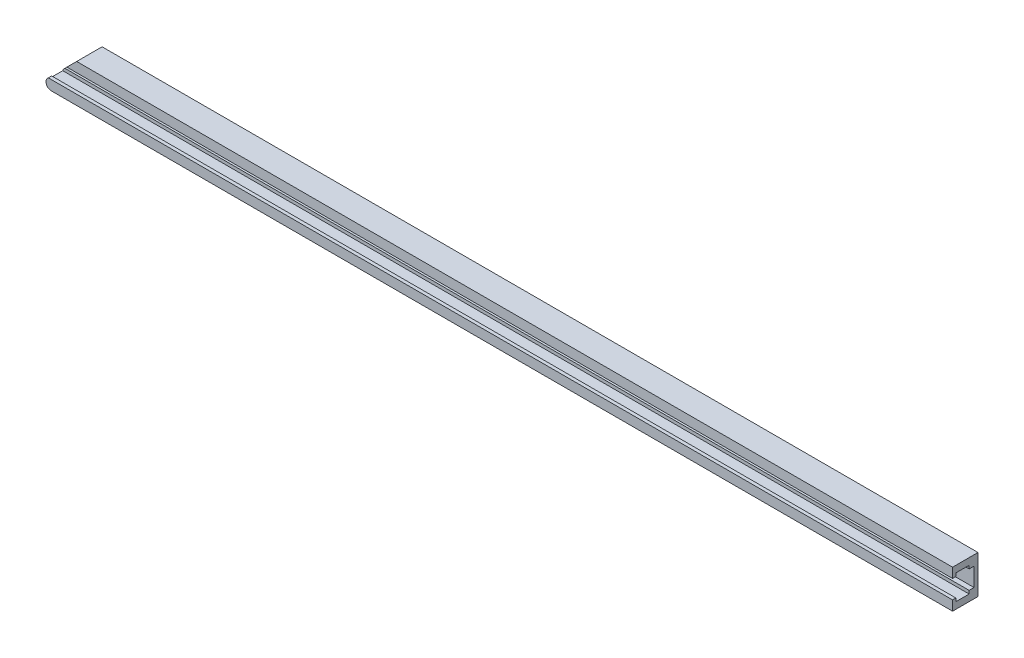
from build123d import *

# Parameters (mm, degrees)
BOSS_EXTRUDE1_DEPTH = 228.6
SKETCH3_R           = 2.413
CUT_EXTRUDE1_DEPTH  = 1.905
LPATTERN1_COUNT     = 3
LPATTERN1_PITCH     = 76.2
CUT_EXTRUDE3_DEPTH  = 230.107436806
FILLET1_R           = 2.54


with BuildPart() as part:
    # Sketch2 → Boss-Extrude1 (new, symmetric)
    with BuildSketch(Plane(origin=(0, 0, 0), x_dir=(0, 0, -1), z_dir=(1, 0, 0))):
        Polygon((0, 9.144), (-12.192, 9.144), (-12.192, 4.445), (-10.6045, 4.445), (-10.6045, 5.969), (-4.2545, 5.969), (-4.2545, 4.445), (-1.905, 4.445), (-1.905, -4.445), (-4.2545, -4.445), (-4.2545, -5.969), (-10.6045, -5.969), (-10.6045, -4.445), (-12.192, -4.445), (-12.192, -9.144), (0, -9.144), align=None)
    extrude(amount=BOSS_EXTRUDE1_DEPTH, both=True)

    # Sketch3 → Cut-Extrude1 (cut)
    with BuildSketch(Plane.XY.offset(1.905)):
        with Locations((38.1, 0)):
            Circle(SKETCH3_R)
    cut_extrude1 = extrude(amount=-CUT_EXTRUDE1_DEPTH, mode=Mode.SUBTRACT)

    # LPattern1: Cut-Extrude1 ×3
    with Locations(*[(i * LPATTERN1_PITCH, 0, 0) for i in range(1, LPATTERN1_COUNT)]):
        add(cut_extrude1, mode=Mode.SUBTRACT)

    # SurfaceCut1
    split(bisect_by=Plane(origin=(0, 0, 0), x_dir=(0, 0, -1), z_dir=(1, 0, 0)), keep=Keep.TOP)

    # Mirror1: part across plane


with BuildPart() as part_1:
    add(part.part)
    add(part.part.mirror(Plane(origin=(0, 0, 0), x_dir=(0, 0, 1), z_dir=(1, 0, 0))))

    # Sketch4 → Cut-Extrude3 (cut, through all)
    with BuildSketch(Plane.XY.offset(12.192)):
        Polygon((-209.55, -9.144), (-191.262, 9.144), (-228.6, 9.144), (-228.6, -9.144), align=None)
    extrude(amount=-CUT_EXTRUDE3_DEPTH, mode=Mode.SUBTRACT)

    # Fillet1
    # the kernel refuses this fillet: 2.54 mm, written as the material it takes off along each edge
    with BuildSketch(Plane(origin=(-209.55, -9.144, 27.522256121), x_dir=(0.7071067811865455, 0.7071067811865496, 0), z_dir=(0, 0, -1))) as fillet1_piece_1:
        with BuildLine():
            CenterArc((FILLET1_R * 2.41421356237, FILLET1_R), FILLET1_R, 135, 135)
            Line((FILLET1_R * 1.70710678119, FILLET1_R * 1.70710678119), (0, 0))
            Line((0, 0), (FILLET1_R * 2.41421356237, 0))
        make_face()
    extrude(amount=42.852512242, mode=Mode.SUBTRACT)


solid = part_1.part
